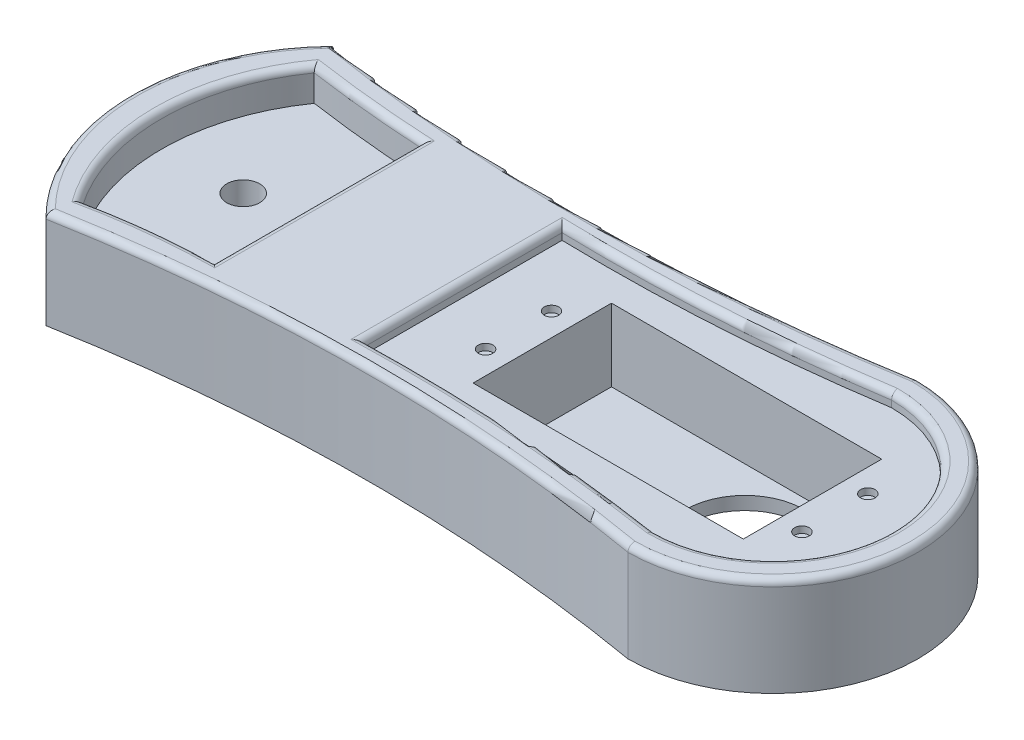
from build123d import *

# Parameters (mm, degrees)
SALIENTE_EXTRUIR1_DEPTH = 15
CORTAR_EXTRUIR2_DEPTH   = 2
CROQUIS3_W              = 41
CROQUIS3_H              = 21
CORTAR_EXTRUIR3_DEPTH   = 11
CROQUIS4_R              = 9
CORTAR_EXTRUIR4_DEPTH   = 101.611139972
CROQUIS5_R              = 1.1
CORTAR_EXTRUIR5_DEPTH   = 1
CORTAR_EXTRUIR13_DEPTH  = 5
CROQUIS7_R              = 2.5
CORTAR_EXTRUIR14_DEPTH  = 101.267649251
REDONDEO2_R             = 1
REDONDEO3_R             = 1


with BuildPart() as part:
    # Croquis1 → Saliente-Extruir1 (new body)
    with BuildSketch(Plane(origin=(0, 0, 0), x_dir=(1, 0, 0), z_dir=(0, 1, 0))):
        with BuildLine():
            ThreePointArc((0, -22), (22, 0), (0, 22))
            ThreePointArc((0, 22), (-44.133753746, 18.164117738), (-88.297835717, 21.633422586))
            ThreePointArc((-88.297835717, 21.633422586), (-97.227552655, -0.44148233), (-87.932501095, -22.365060691))
            ThreePointArc((-87.932501095, -22.365060691), (-43.982219883, -18.335981845), (0, -22))
        make_face()
    extrude(amount=SALIENTE_EXTRUIR1_DEPTH)

    # Croquis2 → Cortar-Extruir2 (cut)
    with BuildSketch(Plane(origin=(0, 15, 0), x_dir=(1, 0, 0), z_dir=(0, 1, 0))):
        with BuildLine():
            Line((-47, 15), (-47, -15))
            ThreePointArc((-47, -15), (-23.432953151, -15.449599362), (0, -18))
            ThreePointArc((0, -18), (18, 0), (0, 18))
            ThreePointArc((0, 18), (-23.433623339, 15.460098979), (-47, 15))
        make_face()
    extrude(amount=-CORTAR_EXTRUIR2_DEPTH, mode=Mode.SUBTRACT)

    # Croquis3 → Cortar-Extruir3 (cut)
    with BuildSketch(Plane(origin=(0, 13, 0), x_dir=(1, 0, 0), z_dir=(0, 1, 0))):
        with Locations((-14.5, 0)):
            Rectangle(CROQUIS3_W, CROQUIS3_H)
    extrude(amount=-CORTAR_EXTRUIR3_DEPTH, mode=Mode.SUBTRACT)

    # Croquis4 → Cortar-Extruir4 (cut, through all)
    with BuildSketch(Plane(origin=(0, 2, 0), x_dir=(1, 0, 0), z_dir=(0, 1, 0))):
        with Locations(Location((-4.25, 0, 0), (0, 0, 270))):
            Circle(CROQUIS4_R)
    extrude(amount=-CORTAR_EXTRUIR4_DEPTH, mode=Mode.SUBTRACT)

    # Croquis5 → Cortar-Extruir5 (cut)
    with BuildSketch(Plane(origin=(0, 13, 0), x_dir=(1, 0, 0), z_dir=(0, 1, 0))):
        with Locations(Location((9.5, 4.9, 0), (0, 0, 270))):
            Circle(CROQUIS5_R)
        with Locations(Location((9.5, -5.1, 0), (0, 0, 270))):
            Circle(CROQUIS5_R)
        with Locations(Location((-38.5, 4.9, 0), (0, 0, 270))):
            Circle(CROQUIS5_R)
        with Locations(Location((-38.5, -5.1, 0), (0, 0, 270))):
            Circle(CROQUIS5_R)
    extrude(amount=-CORTAR_EXTRUIR5_DEPTH, mode=Mode.SUBTRACT)

    # Croquis6 → Cortar-Extruir13 (cut)
    with BuildSketch(Plane(origin=(0, 15, 0), x_dir=(1, 0, 0), z_dir=(0, 1, 0))):
        with BuildLine():
            Line((-68.737734773, 15.427092138), (-68.737734773, -15.97347445))
            ThreePointArc((-68.737734773, -15.97347445), (-77.814777004, -16.578592838), (-86.798496184, -18.010952302))
            ThreePointArc((-86.798496184, -18.010952302), (-92.373186804, -0.406006346), (-86.798496184, 17.198939611))
            ThreePointArc((-86.798496184, 17.198939611), (-77.788079973, 16.109514175), (-68.737734773, 15.427092138))
        make_face()
    extrude(amount=-CORTAR_EXTRUIR13_DEPTH, mode=Mode.SUBTRACT)

    # Croquis7 → Cortar-Extruir14 (cut, through all)
    with BuildSketch(Plane(origin=(0, 10, 0), x_dir=(1, 0, 0), z_dir=(0, 1, 0))):
        with Locations(Location((-80.373306938, 0, 0), (0, 0, 270))):
            Circle(CROQUIS7_R)
    extrude(amount=-CORTAR_EXTRUIR14_DEPTH, mode=Mode.SUBTRACT)

    # Redondeo2
    # the kernel refuses this fillet: 1 mm, written as the material it takes off along each edge
    with BuildSketch(Plane(origin=(-42.931069519, 15, 271.527527752), x_dir=(-0.1874431998722677, 0, -0.9822754434585266), z_dir=(-0.9822754434585266, 0, 0.1874431998722677))) as redondeo2_piece_1:
        with BuildLine():
            CenterArc((253.193727877 + REDONDEO2_R, REDONDEO2_R), REDONDEO2_R, 180, 90)
            Line((253.193727877 + REDONDEO2_R, 0), (253.193727877, 0))
            Line((253.193727877, 0), (253.193727877, REDONDEO2_R))
        make_face()
    revolve(axis=Axis((-42.931069519, 15, 271.527527752), (0, -1, 0)), revolution_arc=21.131483712, mode=Mode.SUBTRACT)
    with BuildSketch(Plane(origin=(0, 15, 0), x_dir=(-0.11357352107267706, 0, 0.9935295945824433), z_dir=(-0.9935295945824433, 0, -0.11357352107267706))) as redondeo2_piece_2:
        with BuildLine():
            CenterArc((22 - REDONDEO2_R, -REDONDEO2_R), REDONDEO2_R, 0, 90)
            Line((22 - REDONDEO2_R, 0), (22, 0))
            Line((22, 0), (22, -REDONDEO2_R))
        make_face()
    revolve(axis=Axis((0, 15, 0), (0, 1, 0)), revolution_arc=193.042709536, mode=Mode.SUBTRACT)
    with BuildSketch(Plane(origin=(-45.249041595, 15, -286.804517852), x_dir=(0.17760158469161672, 0, 0.9841024728731386), z_dir=(0.9841024728731386, 0, -0.17760158469161672))) as redondeo2_piece_3:
        with BuildLine():
            CenterArc((268.642715219 + REDONDEO2_R, REDONDEO2_R), REDONDEO2_R, 180, 90)
            Line((268.642715219, REDONDEO2_R), (268.642715219, 0))
            Line((268.642715219, 0), (268.642715219 + REDONDEO2_R, 0))
        make_face()
    revolve(axis=Axis((-45.249041595, 15, -286.804517852), (0, -1, 0)), revolution_arc=19.984444172, mode=Mode.SUBTRACT)
    with BuildSketch(Plane(origin=(-66.115926768, 15, 0.183151741), x_dir=(-0.6543449081005462, 0, -0.7561962319681894), z_dir=(0.7561962319681894, 0, -0.6543449081005462))) as redondeo2_piece_4:
        with BuildLine():
            CenterArc((31.112698372 - REDONDEO2_R, -REDONDEO2_R), REDONDEO2_R, 0, 90)
            Line((31.112698372 - REDONDEO2_R, 0), (31.112698372, 0))
            Line((31.112698372, 0), (31.112698372, -REDONDEO2_R))
        make_face()
    revolve(axis=Axis((-66.115926768, 15, 0.183151741), (0, 1, 0)), revolution_arc=99.211479347, mode=Mode.SUBTRACT)

    # Redondeo3
    redondeo3_edges = [part.edges().sort_by_distance(p)[0] for p in [
        (-23.433623339, 15, -15.460098979),
        (-47, 15, 0),
        (-23.432953151, 15, 15.449599362),
        (18, 15, 0),
        (-77.788079973, 15, -16.109514175),
        (-68.737734773, 15, 0.273191156),
        (-92.373186804, 15, 0.406006346),
        (-77.814777004, 15, 16.578592838),
    ]]
    fillet(redondeo3_edges, radius=REDONDEO3_R)


solid = part.part
